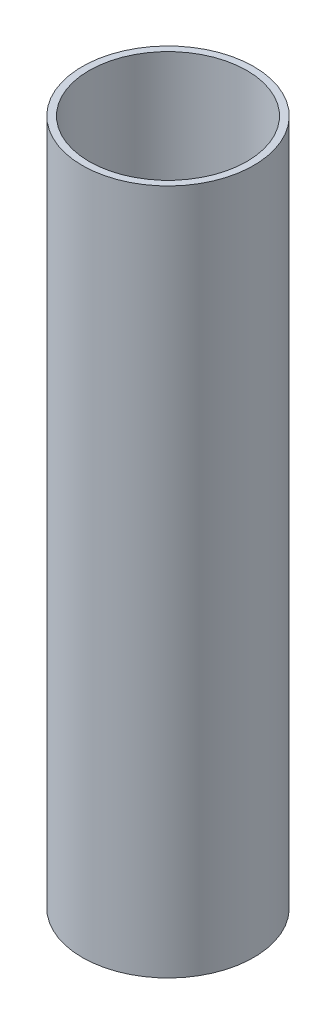
from build123d import *

# Parameters (mm, degrees)
SKETCH_1_R      = 12.5
SKETCH_1_R_2    = 11.5
EXTRUDE_1_DEPTH = 100


with BuildPart() as part:
    # Эскиз1 → Бобышка-Вытянуть1 (new body)
    with BuildSketch(Plane(origin=(0, 0, 0), x_dir=(1, 0, 0), z_dir=(0, 1, 0))):
        Circle(SKETCH_1_R)
        Circle(SKETCH_1_R_2, mode=Mode.SUBTRACT)
    extrude(amount=EXTRUDE_1_DEPTH)


solid = part.part
